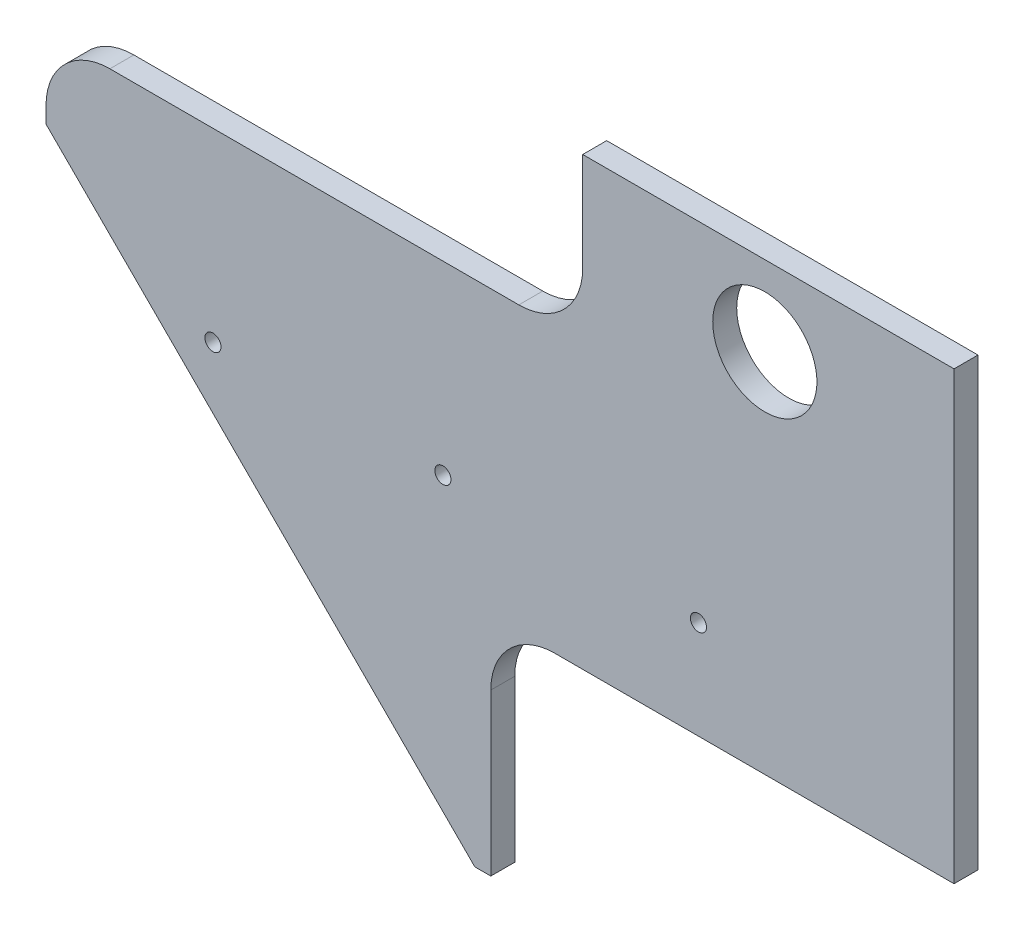
from build123d import *

# Parameters (mm, degrees)
SKETCH1_R                  = 20.701
BOSS_EXTRUDE1_DEPTH        = 9.525
SKETCH2_W                  = 184.15
SKETCH2_H                  = 89.436096718
CUT_EXTRUDE1_DEPTH         = 267.58430025
FILLET1_R                  = 25.4
SKETCH4_W                  = 213.36
SKETCH4_H                  = 65.465352004
CUT_EXTRUDE2_DEPTH         = 267.58430025
FILLET2_R                  = 25.4
F_6_4_6_4_DIAMETER_HOLE2_D = 6.4
SKETCH16_W                 = 9.525
SKETCH16_H                 = 0.985363282
CUT_EXTRUDE3_DEPTH         = 390.572219806


with BuildPart() as part:
    # Sketch1 → Boss-Extrude1 (new body)
    with BuildSketch(Plane.XY):
        Polygon((-138.259383474, 48.991487021), (32.210627804, -121.478524257), (222.710627804, -121.478524257), (222.710627804, 146.206839025), (-138.259383474, 146.206839025), align=None)
        with Locations((147.490616526, 113.471475743)):
            Circle(SKETCH1_R, mode=Mode.SUBTRACT)
    extrude(amount=BOSS_EXTRUDE1_DEPTH)

    # Sketch2 → Cut-Extrude1 (cut, through all)
    with BuildSketch(Plane.XY.offset(9.525)):
        with Locations((130.635627804, -76.760475898)):
            Rectangle(SKETCH2_W, SKETCH2_H)
    extrude(amount=-CUT_EXTRUDE1_DEPTH, mode=Mode.SUBTRACT)

    # Fillet1
    fillet1_edges = [part.edges().sort_by_distance(p)[0] for p in [
        (38.560627804, -32.042427539, 4.7625),
    ]]
    fillet(fillet1_edges, radius=FILLET1_R)

    # Sketch4 → Cut-Extrude2 (cut, through all)
    with BuildSketch(Plane.XY.offset(9.525)):
        with Locations((-31.579383474, 113.474163023)):
            Rectangle(SKETCH4_W, SKETCH4_H)
    extrude(amount=-CUT_EXTRUDE2_DEPTH, mode=Mode.SUBTRACT)

    # Fillet2
    fillet2_edges = [part.edges().sort_by_distance(p)[0] for p in [
        (-138.259383474, 80.741487021, 4.7625),
        (75.100616526, 80.741487021, 4.7625),
    ]]
    fillet(fillet2_edges, radius=FILLET2_R)

    # Ø6.4 (6.4) Diameter Hole2 (through all)
    with Locations(Plane(origin=(0, 0, 0), x_dir=(-1, 0, 0), z_dir=(0, 0, -1))):
        with Locations((-121.110627804, 7.042935743), (-19.510627804, 7.042935743), (71.895728372, 7.042935743)):
            Hole(F_6_4_6_4_DIAMETER_HOLE2_D / 2)

    # Sketch16 → Cut-Extrude3 (cut, through all)
    with BuildSketch(Plane(origin=(222.710627804, 0, 0), x_dir=(0, 0, -1), z_dir=(1, 0, 0))):
        with Locations((-4.7625, 145.714157384)):
            Rectangle(SKETCH16_W, SKETCH16_H)
    extrude(amount=-CUT_EXTRUDE3_DEPTH, mode=Mode.SUBTRACT)


solid = part.part
